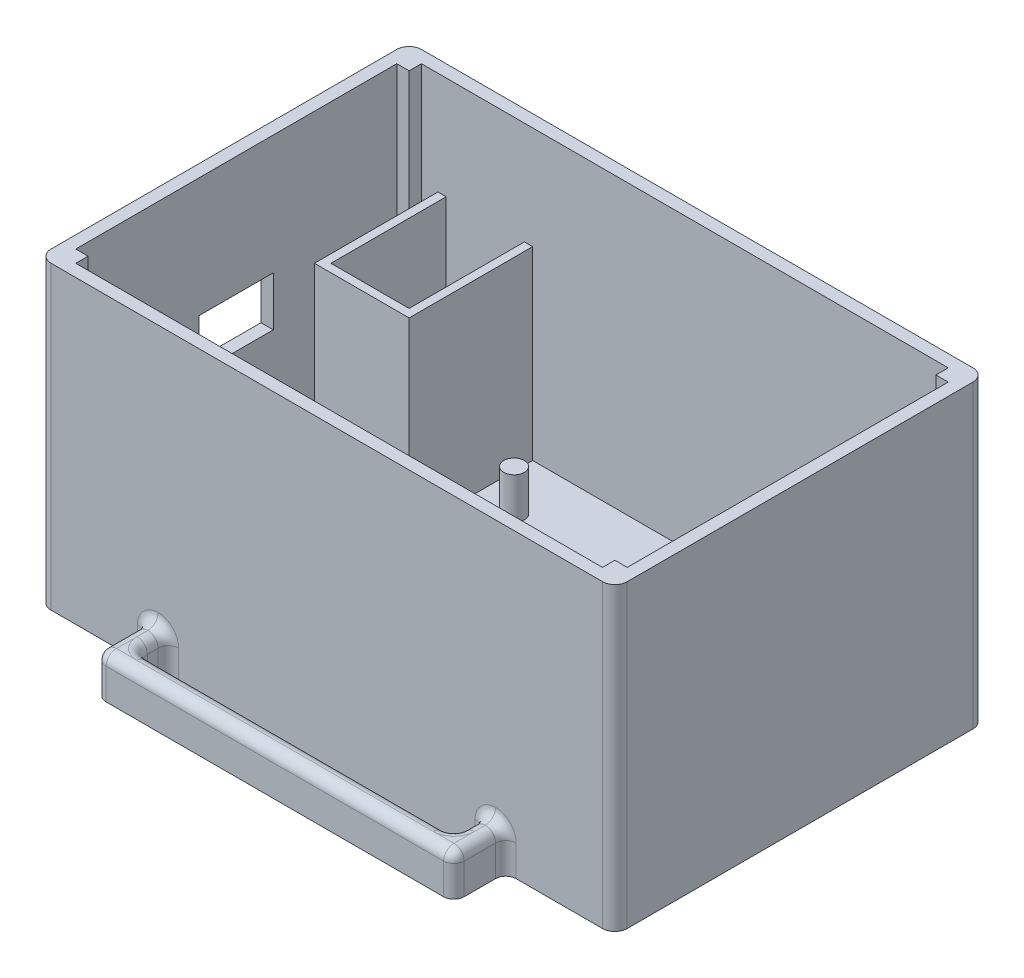
from build123d import *

# Parameters (mm, degrees)
CORPO_CENTRALE_DEPTH = 70
SCHIZZO13_W          = 18
SCHIZZO13_H          = 12
ON_OFF_DEPTH         = 3
FONDO_START          = 3
FONDO_DEPTH          = 3
MANIGLIA_1_DEPTH     = 10
RACCORDO55_R         = 2.5
RACCORDO56_R         = 2.5
RACCORDO57_R         = 2.5
RACCORDO58_R         = 2.5
RACCORDO62_R         = 2.5
RACCORDO63_R         = 2.5
RACCORDO64_R         = 2.5
RACCORDO65_R         = 2.5
SCHIZZO25_R          = 2.5
ATTACCO_PCB_DEPTH    = 10
CASE_BATTERIA_DEPTH  = 45


with BuildPart() as part:
    # Schizzo2 → Corpo centrale (new body)
    with BuildSketch(Plane(origin=(0, 0, 0), x_dir=(1, 0, 0), z_dir=(0, 1, 0))):
        with BuildLine():
            Line((-22.339499477, 77.047489197), (111.660500523, 77.047489197))
            ThreePointArc((111.660500523, 77.047489197), (113.781820867, 76.168809541), (114.660500523, 74.047489197))
            Line((114.660500523, 74.047489197), (114.660500523, -9.952510803))
            ThreePointArc((114.660500523, -9.952510803), (113.781820867, -12.073831146), (111.660500523, -12.952510803))
            Line((111.660500523, -12.952510803), (-22.339499477, -12.952510803))
            ThreePointArc((-22.339499477, -12.952510803), (-24.460819821, -12.073831146), (-25.339499477, -9.952510803))
            Line((-25.339499477, -9.952510803), (-25.339499477, 74.047489197))
            ThreePointArc((-25.339499477, 74.047489197), (-24.460819821, 76.168809541), (-22.339499477, 77.047489197))
        make_face()
        Polygon((-22.339499477, 71.047489197), (-19.339499477, 71.047489197), (-19.339499477, 74.047489197), (108.660500523, 74.047489197), (108.660500523, 71.047489197), (111.660500523, 71.047489197), (111.660500523, -6.952510803), (108.660500523, -6.952510803), (108.660500523, -9.952510803), (-19.339499477, -9.952510803), (-19.339499477, -6.952510803), (-22.339499477, -6.952510803), align=None, mode=Mode.SUBTRACT)
    extrude(amount=CORPO_CENTRALE_DEPTH)

    # Schizzo13 → On/off (cut)
    with BuildSketch(Plane.ZY.offset(25.339499477)):
        with Locations((-32.047489197, 35)):
            Rectangle(SCHIZZO13_W, SCHIZZO13_H)
    extrude(amount=-ON_OFF_DEPTH, mode=Mode.SUBTRACT)

    # Schizzo18 → Fondo (add)
    with BuildSketch(Plane.XZ.offset(FONDO_START)):
        with BuildLine():
            Line((-25.339499477, 9.952510803), (-25.339499477, -74.047489197))
            ThreePointArc((-25.339499477, -74.047489197), (-24.460819821, -76.168809541), (-22.339499477, -77.047489197))
            Line((-22.339499477, -77.047489197), (111.660500523, -77.047489197))
            ThreePointArc((111.660500523, -77.047489197), (113.781820867, -76.168809541), (114.660500523, -74.047489197))
            Line((114.660500523, -74.047489197), (114.660500523, 9.952510803))
            ThreePointArc((114.660500523, 9.952510803), (113.781820867, 12.073831146), (111.660500523, 12.952510803))
            Line((111.660500523, 12.952510803), (-22.339499477, 12.952510803))
            ThreePointArc((-22.339499477, 12.952510803), (-24.460819821, 12.073831146), (-25.339499477, 9.952510803))
        make_face()
    extrude(amount=-FONDO_DEPTH)

    # Schizzo23 → Maniglia 1 (add)
    with BuildSketch(Plane.XZ.offset(3)):
        with BuildLine():
            Line((1.160500523, 12.952510803), (1.160500523, 23.072411806))
            ThreePointArc((1.160500523, 23.072411806), (1.89273357, 24.840178759), (3.660500523, 25.572411806))
            Line((3.660500523, 25.572411806), (85.660500523, 25.572411806))
            ThreePointArc((85.660500523, 25.572411806), (87.428267476, 24.840178759), (88.160500523, 23.072411806))
            Line((88.160500523, 23.072411806), (88.160500523, 12.952510803))
            Line((88.160500523, 12.952510803), (83.160500523, 12.952510803))
            Line((83.160500523, 12.952510803), (83.160500523, 18.072411806))
            ThreePointArc((83.160500523, 18.072411806), (82.428267476, 19.840178759), (80.660500523, 20.572411806))
            Line((80.660500523, 20.572411806), (8.660500523, 20.572411806))
            ThreePointArc((8.660500523, 20.572411806), (6.89273357, 19.840178759), (6.160500523, 18.072411806))
            Line((6.160500523, 18.072411806), (6.160500523, 12.952510803))
            Line((6.160500523, 12.952510803), (1.160500523, 12.952510803))
        make_face()
    maniglia_1 = extrude(amount=-MANIGLIA_1_DEPTH)

    # Maniglia 2: Maniglia 1 across plane
    add(maniglia_1.mirror(Plane.XY.offset(-32.047489197)))

    # Raccordo55
    raccordo55_edges = [part.edges().sort_by_distance(p)[0] for p in [
        (1.160500523, 7, 18.012461305),
        (1.89273357, 7, 24.840178759),
        (44.660500523, 7, 25.572411806),
        (87.428267476, 7, 24.840178759),
        (88.160500523, 7, 18.012461305),
    ]]
    fillet(raccordo55_edges, radius=RACCORDO55_R)

    # Raccordo56
    raccordo56_edges = [part.edges().sort_by_distance(p)[0] for p in [
        (82.428267476, 7, 19.840178759),
        (83.160500523, 7, 15.512461305),
        (44.660500523, 7, 20.572411806),
        (6.89273357, 7, 19.840178759),
        (6.160500523, 7, 15.512461305),
    ]]
    fillet(raccordo56_edges, radius=RACCORDO56_R - 0.0001)  # a hair under: the kernel refuses the full size

    # Raccordo57
    raccordo57_edges = [part.edges().sort_by_distance(p)[0] for p in [
        (1.160500523, 0.75, 12.952510803),
        (1.89273357, 6.267766953, 12.952510803),
        (6.160500523, 0.75005, 12.952510803),
        (5.428296765, 6.267796242, 12.952510803),
    ]]
    fillet(raccordo57_edges, radius=RACCORDO57_R)

    # Raccordo58
    raccordo58_edges = [part.edges().sort_by_distance(p)[0] for p in [
        (88.160500523, 0.75, 12.952510803),
        (87.428267476, 6.267766953, 12.952510803),
        (83.160500523, 0.75005, 12.952510803),
        (83.892704281, 6.267796242, 12.952510803),
    ]]
    fillet(raccordo58_edges, radius=RACCORDO58_R)

    # Raccordo62
    raccordo62_edges = [part.edges().sort_by_distance(p)[0] for p in [
        (88.160500523, 7, -82.107439699),
        (87.428267476, 7, -88.935157154),
        (44.660500523, 7, -89.667390201),
        (1.89273357, 7, -88.935157154),
        (1.160500523, 7, -82.107439699),
    ]]
    fillet(raccordo62_edges, radius=RACCORDO62_R)

    # Raccordo63
    raccordo63_edges = [part.edges().sort_by_distance(p)[0] for p in [
        (82.428267476, 7, -83.935157154),
        (6.160500523, 7, -79.607439699),
        (6.89273357, 7, -83.935157154),
        (44.660500523, 7, -84.667390201),
        (83.160500523, 7, -79.607439699),
    ]]
    fillet(raccordo63_edges, radius=RACCORDO63_R - 0.0001)  # a hair under: the kernel refuses the full size

    # Raccordo64
    raccordo64_edges = [part.edges().sort_by_distance(p)[0] for p in [
        (88.160500523, 0.75, -77.047489197),
        (87.428267476, 6.267766953, -77.047489197),
        (83.160500523, 0.75005, -77.047489197),
        (83.892704281, 6.267796242, -77.047489197),
    ]]
    fillet(raccordo64_edges, radius=RACCORDO64_R)

    # Raccordo65
    raccordo65_edges = [part.edges().sort_by_distance(p)[0] for p in [
        (1.160500523, 0.75, -77.047489197),
        (1.89273357, 6.267766953, -77.047489197),
        (6.160500523, 0.75005, -77.047489197),
        (5.428296765, 6.267796242, -77.047489197),
    ]]
    fillet(raccordo65_edges, radius=RACCORDO65_R)

    # Schizzo25 → Attacco PCB (add)
    with BuildSketch(Plane(origin=(0, 0, 0), x_dir=(1, 0, 0), z_dir=(0, 1, 0))):
        with Locations(Location((99.660500523, 60.547489197, 0), (0, 0, 90))):
            Circle(SCHIZZO25_R)
        with Locations(Location((102.660500523, 0.547489197, 0), (0, 0, 90))):
            Circle(SCHIZZO25_R)
        with Locations(Location((16.660500523, 3.547489197, 0), (0, 0, 90))):
            Circle(SCHIZZO25_R)
        with Locations(Location((16.660500523, 60.547489197, 0), (0, 0, 90))):
            Circle(SCHIZZO25_R)
    extrude(amount=ATTACCO_PCB_DEPTH)

    # Schizzo26 → Case Batteria (add)
    with BuildSketch(Plane(origin=(0, 0, 0), x_dir=(1, 0, 0), z_dir=(0, 1, 0))):
        Polygon((-13.339499477, 74.047489197), (-15.339499477, 74.047489197), (-15.339499477, 44.047489197), (7.660500523, 44.047489197), (7.660500523, 74.047489197), (5.660500523, 74.047489197), (5.660500523, 46.047489197), (-13.339499477, 46.047489197), align=None)
    extrude(amount=CASE_BATTERIA_DEPTH)


solid = part.part
